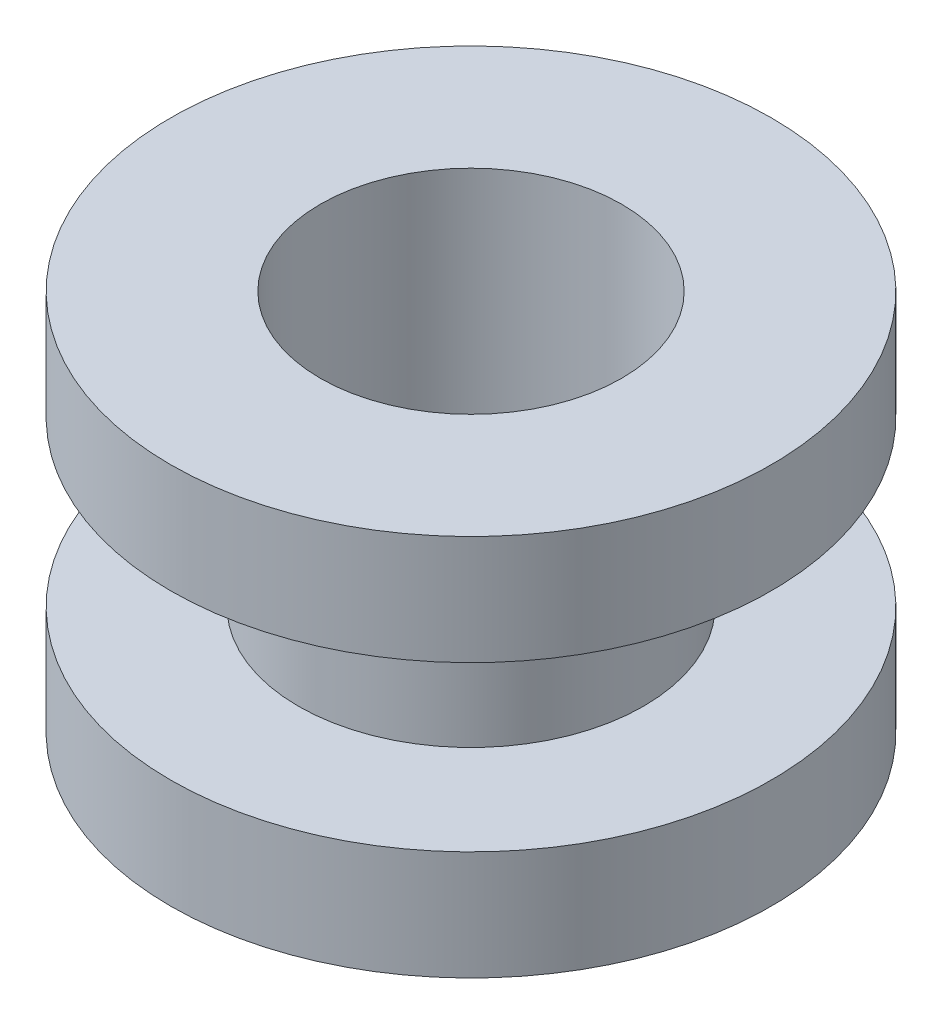
from build123d import *

# Parameters (mm, degrees)
SKETCH1_R      = 20.066
SKETCH1_R_2    = 17.526
EXTRUDE1_DEPTH = 44.45
EXTRUDE2_START = -12.7
SKETCH2_R      = 34.925
SKETCH2_R_2    = 17.526
EXTRUDE2_DEPTH = 12.7
SKETCH3_R      = 34.925
SKETCH3_R_2    = 17.526
EXTRUDE3_DEPTH = 12.7


with BuildPart() as part:
    # Sketch1 → Extrude1 (new body)
    with BuildSketch(Plane(origin=(0, 0, 0), x_dir=(1, 0, 0), z_dir=(0, 1, 0))):
        Circle(SKETCH1_R)
        Circle(SKETCH1_R_2, mode=Mode.SUBTRACT)
    extrude(amount=EXTRUDE1_DEPTH)

    # Sketch2 → Extrude2 (add)
    with BuildSketch(Plane(origin=(0, 44.45, 0), x_dir=(1, 0, 0), z_dir=(0, 1, 0)).offset(EXTRUDE2_START)):
        Circle(SKETCH2_R)
        Circle(SKETCH2_R_2, mode=Mode.SUBTRACT)
    extrude(amount=EXTRUDE2_DEPTH)

    # Sketch3 → Extrude3 (add)
    with BuildSketch(Plane.XZ):
        Circle(SKETCH3_R)
        Circle(SKETCH3_R_2, mode=Mode.SUBTRACT)
    extrude(amount=-EXTRUDE3_DEPTH)


solid = part.part
